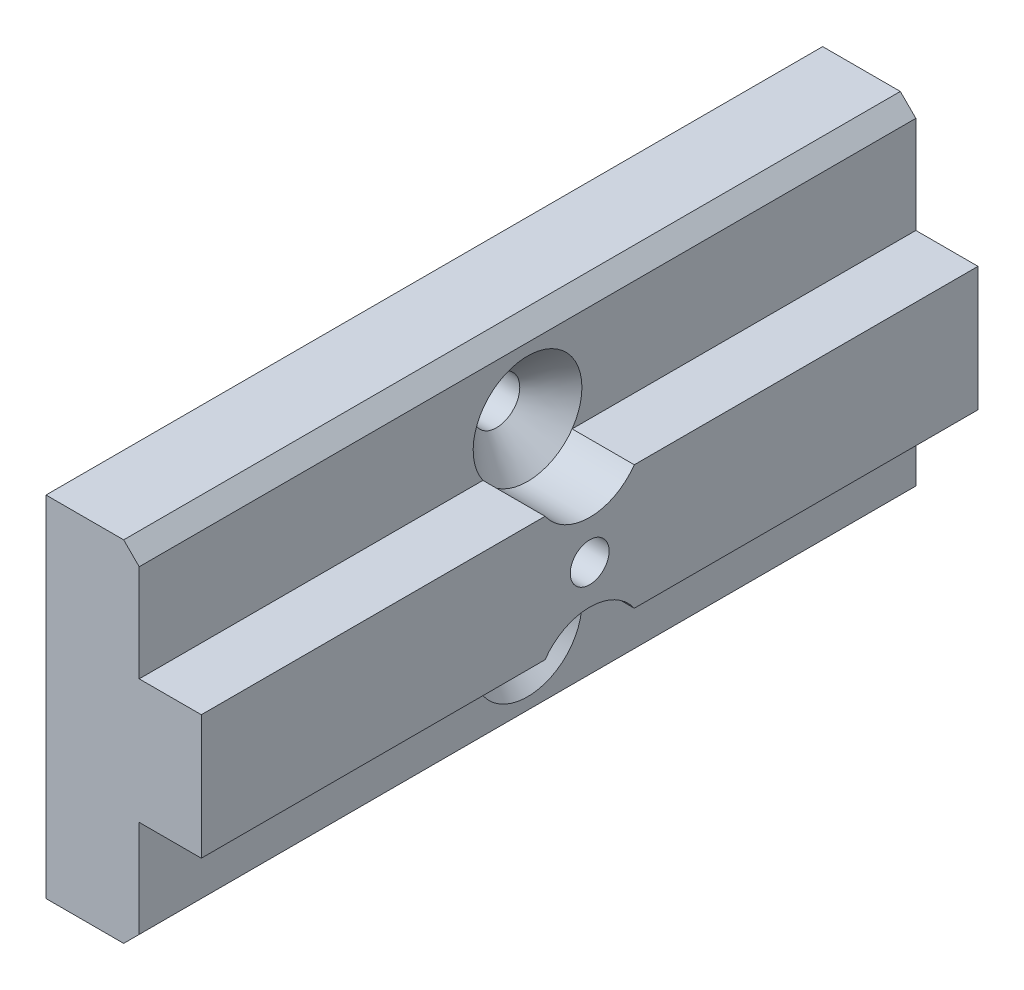
from build123d import *

# Parameters (mm, degrees)
SKETCH_1_W          = 50
SKETCH_1_H          = 22.5
EXTRUDE_1_DEPTH     = 6
SKETCH_2_W          = 50
SKETCH_2_H          = 8
EXTRUDE_2_DEPTH     = 4
SKETCH_3_R          = 1.5
SKETCH_3_R_2        = 1.25
CUT_EXTRUDE_1_DEPTH = 30.181543825
SKETCH_4_R          = 3.5
CUT_EXTRUDE_2_DEPTH = 29.063543967
CHAMFER_1_SIZE      = 2
CHAMFER_2_SIZE      = 1


with BuildPart() as part:
    # 草图1 → 凸台-拉伸1 (new body)
    with BuildSketch(Plane(origin=(0, 0, 0), x_dir=(0, 0, -1), z_dir=(1, 0, 0))):
        Rectangle(SKETCH_1_W, SKETCH_1_H)
    extrude(amount=EXTRUDE_1_DEPTH)

    # 草图2 → 凸台-拉伸2 (add)
    with BuildSketch(Plane(origin=(6, 0, 0), x_dir=(0, 0, -1), z_dir=(1, 0, 0))):
        Rectangle(SKETCH_2_W, SKETCH_2_H)
    extrude(amount=EXTRUDE_2_DEPTH)

    # 草图3 → 切除-拉伸1 (cut, through all)
    with BuildSketch(Plane.ZY):
        with Locations((0, 6)):
            Circle(SKETCH_3_R)
        with Locations((0, -6)):
            Circle(SKETCH_3_R)
        Circle(SKETCH_3_R_2)
    extrude(amount=-CUT_EXTRUDE_1_DEPTH, mode=Mode.SUBTRACT)

    # 草图4 → 切除-拉伸2 (cut, through all)
    with BuildSketch(Plane(origin=(6, 0, 0), x_dir=(0, 0, -1), z_dir=(1, 0, 0))):
        with Locations((0, 6)):
            Circle(SKETCH_4_R)
        with Locations((0, -6)):
            Circle(SKETCH_4_R)
    extrude(amount=CUT_EXTRUDE_2_DEPTH, mode=Mode.SUBTRACT)

    # 倒角1
    chamfer_1_edges = [part.edges().sort_by_distance(p)[0] for p in [
        (6, 6, -1.5),
        (6, -6, -1.5),
    ]]
    chamfer(chamfer_1_edges, length=CHAMFER_1_SIZE - 0.0001)  # a hair under: the kernel refuses the full size

    # 倒角2
    chamfer_2_edges = [part.edges().sort_by_distance(p)[0] for p in [
        (6, 11.25, 0),
        (6, -11.25, 0),
    ]]
    chamfer(chamfer_2_edges, length=CHAMFER_2_SIZE)


solid = part.part
